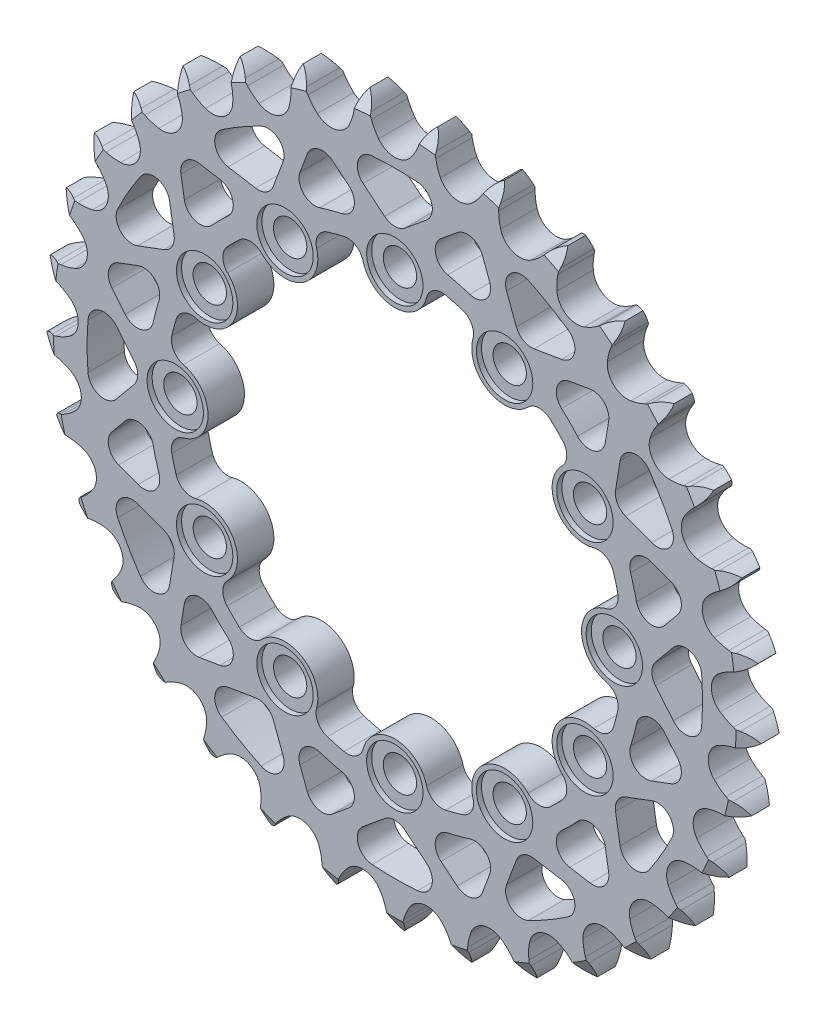
from build123d import *

# Parameters (mm, degrees)
EXTRUSION_DEPTH          = 7.2136
CIRPATTERN1_COUNT        = 12
CUT_EXTRUDE1_DEPTH       = 101.397293257
CUT_EXTRUDE1_DEPTH_BACK  = 101.397293257
SKETCH8_R                = 37
CUT_EXTRUDE2_START       = 7.2136
SKETCH10_R               = 5.588
CUT_EXTRUDE2_DEPTH       = 1.016
CIRPATTERN2_COUNT        = 12
CUT_EXTRUDE3_DEPTH       = 101.397293405
FILLET1_R                = 3.175
CUT_EXTRUDE4_DEPTH       = 101.397293405
FILLET3_R                = 3.175
CIRPATTERN4_COUNT        = 12
FILLET1_OF_CIRPATTERN4_R = 3.175
FILLET3_OF_CIRPATTERN4_R = 3.175


with BuildPart() as part:
    # Teeth Sketch → Extrusion (new body)
    with BuildSketch(Plane.XY):
        with BuildLine():
            ThreePointArc((6.734552875, 70.527428506), (5.727412099, 69.369502295), (5.022388138, 68.006393031))
            Line((5.022388138, 68.006393031), (4.635162245, 66.971544668))
            ThreePointArc((4.635162245, 66.971544668), (4.0137299, 65.635158722), (3.209237245, 64.400291471))
            ThreePointArc((3.209237245, 64.400291471), (0, 62.793862006), (-3.209237245, 64.400291471))
            ThreePointArc((-3.209237245, 64.400291471), (-4.0137299, 65.635158722), (-4.635162245, 66.971544668))
            Line((-4.635162245, 66.971544668), (-5.022388138, 68.006393031))
            ThreePointArc((-5.022388138, 68.006393031), (-5.727412099, 69.369502295), (-6.734552875, 70.527428506))
            ThreePointArc((-6.734552875, 70.527428506), (-7.504354329, 69.199824885), (-7.938667464, 67.727922119))
            Line((-7.938667464, 67.727922119), (-8.123049341, 66.638491832))
            ThreePointArc((-8.123049341, 66.638491832), (-8.48033889, 65.208649276), (-9.036593151, 63.84384645))
            ThreePointArc((-9.036593151, 63.84384645), (-11.883816523, 61.659095115), (-15.339077445, 62.629142165))
            ThreePointArc((-15.339077445, 62.629142165), (-16.362732034, 63.68944252), (-17.22584699, 64.884071387))
            Line((-17.22584699, 64.884071387), (-17.801921547, 65.826935709))
            ThreePointArc((-17.801921547, 65.826935709), (-18.752174931, 67.031985151), (-19.960254337, 67.978383482))
            ThreePointArc((-19.960254337, 67.978383482), (-20.464893839, 66.529085505), (-20.61279894, 65.001587639))
            Line((-20.61279894, 65.001587639), (-20.587672758, 63.896950277))
            ThreePointArc((-20.587672758, 63.896950277), (-20.667906137, 62.425329346), (-20.955817525, 60.979918474))
            ThreePointArc((-20.955817525, 60.979918474), (-23.338120953, 58.295807876), (-26.914523421, 58.594412483))
            ThreePointArc((-26.914523421, 58.594412483), (-28.120342399, 59.441823925), (-29.193944743, 60.451518712))
            Line((-29.193944743, 60.451518712), (-29.938047129, 61.268321421))
            ThreePointArc((-29.938047129, 61.268321421), (-31.099185303, 62.271757414), (-32.464540202, 62.972422563))
            ThreePointArc((-32.464540202, 62.972422563), (-32.685778765, 61.453811636), (-32.541930156, 59.925926421))
            Line((-32.541930156, 59.925926421), (-32.308204042, 58.846006456))
            ThreePointArc((-32.308204042, 58.846006456), (-32.108481407, 57.385795366), (-32.117644055, 55.912017363))
            ThreePointArc((-32.117644055, 55.912017363), (-33.948924886, 52.825558252), (-37.517208396, 52.441928068))
            ThreePointArc((-37.517208396, 52.441928068), (-38.861610323, 53.045822938), (-40.106897269, 53.834090646))
            Line((-40.106897269, 53.834090646), (-40.992133685, 54.495310364))
            ThreePointArc((-40.992133685, 54.495310364), (-42.32219009, 55.260866117), (-43.795472998, 55.69047422))
            ThreePointArc((-43.795472998, 55.69047422), (-43.725314484, 54.157436897), (-43.294911229, 52.684386087))
            Line((-43.294911229, 52.684386087), (-42.861032653, 51.668214641))
            ThreePointArc((-42.861032653, 51.668214641), (-42.388572501, 50.272189225), (-42.118655247, 48.823310267))
            ThreePointArc((-42.118655247, 48.823310267), (-43.33272622, 45.446055318), (-46.763923708, 44.394055736))
            ThreePointArc((-46.763923708, 44.394055736), (-48.198318397, 44.732607702), (-49.570282031, 45.270958281))
            Line((-49.570282031, 45.270958281), (-50.564657725, 45.752696804))
            ThreePointArc((-50.564657725, 45.752696804), (-52.015560657, 46.252703137), (-53.543523293, 46.395727039))
            ThreePointArc((-53.543523293, 46.395727039), (-53.184503413, 44.903671283), (-52.483101407, 43.538694772))
            Line((-52.483101407, 43.538694772), (-51.864751871, 42.622998928))
            ThreePointArc((-51.864751871, 42.622998928), (-51.136630142, 41.341615182), (-50.597388499, 39.970001531))
            ThreePointArc((-50.597388499, 39.970001531), (-51.150369926, 36.424013535), (-54.320468976, 34.741666562))
            ThreePointArc((-54.320468976, 34.741666562), (-55.793013665, 34.802639473), (-57.242067645, 35.071615531))
            Line((-57.242067645, 35.071615531), (-58.309643291, 35.356461573))
            ThreePointArc((-58.309643291, 35.356461573), (-59.828953337, 35.572846956), (-61.356371149, 35.424117399))
            ThreePointArc((-61.356371149, 35.424117399), (-60.721465817, 34.026969994), (-59.774415556, 32.819401589))
            Line((-59.774415556, 32.819401589), (-58.993943824, 32.037276981))
            ThreePointArc((-58.993943824, 32.037276981), (-58.036476735, 30.916847451), (-57.2474003, 29.672072798))
            ThreePointArc((-57.2474003, 29.672072798), (-57.119305992, 26.085513002), (-59.913730964, 23.83362304))
            ThreePointArc((-59.913730964, 23.83362304), (-61.371204052, 23.614813176), (-62.844975793, 23.604693218))
            Line((-62.844975793, 23.604693218), (-63.947166423, 23.682351702))
            ThreePointArc((-63.947166423, 23.682351702), (-65.479971761, 23.607295402), (-66.951639889, 23.17218786))
            ThreePointArc((-66.951639889, 23.17218786), (-66.063796239, 21.920445353), (-64.905326586, 20.913929722))
            Line((-64.905326586, 20.913929722), (-63.99094094, 20.293644371))
            ThreePointArc((-63.99094094, 20.293644371), (-62.838733846, 19.374664301), (-61.828341898, 18.301718044))
            ThreePointArc((-61.828341898, 18.301718044), (-61.023801517, 14.804214063), (-63.341554612, 12.064170283))
            ThreePointArc((-63.341554612, 12.064170283), (-64.731279223, 11.573486003), (-66.176502774, 11.28463579))
            Line((-66.176502774, 11.28463579), (-67.273472348, 11.152299936))
            ThreePointArc((-67.273472348, 11.152299936), (-68.764373399, 10.788514683), (-70.127101923, 10.082755077))
            ThreePointArc((-70.127101923, 10.082755077), (-69.018408937, 9.021658703), (-67.690390004, 8.252573944))
            Line((-67.690390004, 8.252573944), (-66.675138724, 7.816546579))
            ThreePointArc((-66.675138724, 7.816546579), (-65.369835391, 7.132230303), (-64.174646128, 6.269891516))
            ThreePointArc((-64.174646128, 6.269891516), (-62.722737859, 2.987852256), (-64.480049441, -0.14131302))
            ThreePointArc((-64.480049441, -0.14131302), (-65.751797307, -0.886137108), (-67.116238523, -1.443277777))
            Line((-67.116238523, -1.443277777), (-68.168339704, -1.780825007))
            ThreePointArc((-68.168339704, -1.780825007), (-69.563451418, -2.420191065), (-70.767987779, -3.371094744))
            ThreePointArc((-70.767987779, -3.371094744), (-69.478516511, -4.203194198), (-68.028946362, -4.707051357))
            Line((-68.028946362, -4.707051357), (-66.949523274, -4.943061572))
            ThreePointArc((-66.949523274, -4.943061572), (-65.538300765, -5.367981082), (-64.201511441, -5.988545228))
            ThreePointArc((-64.201511441, -5.988545228), (-62.154711032, -8.936498316), (-63.288067282, -12.341688903))
            ThreePointArc((-63.288067282, -12.341688903), (-64.395874122, -13.313732915), (-65.630218543, -14.119027525))
            Line((-65.630218543, -14.119027525), (-66.599425651, -14.649586294))
            ThreePointArc((-66.599425651, -14.649586294), (-67.848325057, -15.541424803), (-68.851134172, -16.703104419))
            ThreePointArc((-68.851134172, -16.703104419), (-67.427489473, -17.276132709), (-65.908759351, -17.496551559))
            Line((-65.908759351, -17.496551559), (-64.804177617, -17.524014599))
            ThreePointArc((-64.804177617, -17.524014599), (-63.338041192, -17.674179644), (-61.907966855, -18.030540344))
            ThreePointArc((-61.907966855, -18.030540344), (-59.340251006, -20.537860555), (-59.808689476, -24.096003993))
            ThreePointArc((-59.808689476, -24.096003993), (-60.712516265, -25.260135726), (-61.772151467, -26.284478831))
            Line((-61.772151467, -26.284478831), (-62.623434833, -26.988873364))
            ThreePointArc((-62.623434833, -26.988873364), (-63.680983452, -28.100950955), (-64.445821187, -29.43142038))
            ThreePointArc((-64.445821187, -29.43142038), (-62.939457285, -29.724666771), (-61.406458053, -29.6536808))
            Line((-61.406458053, -29.6536808), (-60.316640136, -29.471604079))
            ThreePointArc((-60.316640136, -29.471604079), (-58.848579784, -29.341587304), (-57.376907048, -29.420864754))
            ThreePointArc((-57.376907048, -29.420864754), (-54.381079699, -31.396931003), (-54.167669802, -34.979426717))
            ThreePointArc((-54.167669802, -34.979426717), (-54.834849884, -36.293571418), (-55.681477891, -37.499940589))
            Line((-55.681477891, -37.499940589), (-56.384069915, -38.352712231))
            ThreePointArc((-56.384069915, -38.352712231), (-57.212045185, -39.644835523), (-57.711268312, -41.096008126))
            ThreePointArc((-57.711268312, -41.096008126), (-56.176629123, -41.09887393), (-54.684767369, -40.739048756))
            Line((-54.684767369, -40.739048756), (-53.649102126, -40.354013001))
            ThreePointArc((-53.649102126, -40.354013001), (-52.232177374, -39.94851355), (-50.772096325, -39.747842457))
            ThreePointArc((-50.772096325, -39.747842457), (-47.456434483, -41.12123456), (-46.56888941, -44.598601821))
            ThreePointArc((-46.56888941, -44.598601821), (-46.975309158, -46.015262876), (-47.578330627, -47.360056788))
            Line((-47.578330627, -47.360056788), (-48.106837804, -48.330384151))
            ThreePointArc((-48.106837804, -48.330384151), (-48.675314541, -49.755852442), (-48.890879835, -51.275279063))
            ThreePointArc((-48.890879835, -51.275279063), (-47.383431219, -50.987660703), (-45.986626711, -50.352001344))
            Line((-45.986626711, -50.352001344), (-45.042545785, -49.777922752))
            ThreePointArc((-45.042545785, -49.777922752), (-43.727967985, -49.111596431), (-42.332249756, -48.638229571))
            ThreePointArc((-42.332249756, -48.638229571), (-38.816590078, -49.35930956), (-37.28698802, -52.605867255))
            ThreePointArc((-37.28698802, -52.605867255), (-37.417958367, -54.073842843), (-37.75557853, -55.50845714))
            Line((-37.75557853, -55.50845714), (-38.090899233, -56.561270064))
            ThreePointArc((-38.090899233, -56.561270064), (-38.379331208, -58.068563217), (-38.303447577, -59.601327819))
            ThreePointArc((-38.303447577, -59.601327819), (-36.877672653, -59.03362057), (-35.626409548, -58.145101414))
            Line((-35.626409548, -58.145101414), (-34.808034481, -57.402728679))
            ThreePointArc((-34.808034481, -57.402728679), (-33.6433159, -56.499658259), (-32.362405386, -55.770704343))
            ThreePointArc((-32.362405386, -55.770704343), (-28.773812973, -55.813410509), (-26.657437732, -58.711819583))
            ThreePointArc((-26.657437732, -58.711819583), (-26.508225068, -60.178053241), (-26.568241455, -61.650637225))
            Line((-26.568241455, -61.650637225), (-26.69825632, -62.747884308))
            ThreePointArc((-26.69825632, -62.747884308), (-26.696218847, -64.28252482), (-26.331628924, -65.773229298))
            ThreePointArc((-26.331628924, -65.773229298), (-25.039058915, -64.94595158), (-23.978561119, -63.836686022))
            Line((-23.978561119, -63.836686022), (-23.31547012, -62.952850431))
            ThreePointArc((-23.31547012, -62.952850431), (-22.342706722, -61.845675228), (-21.222899365, -60.887480551))
            ThreePointArc((-21.222899365, -60.887480551), (-17.691075297, -60.250269381), (-15.06441819, -62.69577378))
            ThreePointArc((-15.06441819, -62.69577378), (-14.640415448, -64.107272002), (-14.42065891, -65.564602652))
            Line((-14.42065891, -65.564602652), (-14.340668861, -66.666626525))
            ThreePointArc((-14.340668861, -66.666626525), (-14.048235582, -68.17314849), (-13.408116596, -69.567914899))
            ThreePointArc((-13.408116596, -69.567914899), (-12.295468348, -68.510966685), (-11.464065017, -67.221046473))
            Line((-11.464065017, -67.221046473), (-10.980223921, -66.227692145))
            ThreePointArc((-10.980223921, -66.227692145), (-10.23457391, -64.956428358), (-9.316342465, -63.80362457))
            ThreePointArc((-9.316342465, -63.80362457), (-5.968936066, -62.509526537), (-2.926931324, -64.413739359))
            ThreePointArc((-2.926931324, -64.413739359), (-2.24346307, -65.719486924), (-1.751876179, -67.108892511))
            Line((-1.751876179, -67.108892511), (-1.464772265, -68.175863162))
            ThreePointArc((-1.464772265, -68.175863162), (-0.89251248, -69.59981695), (0, -70.848234798))
            ThreePointArc((0, -70.848234798), (0.89251248, -69.59981695), (1.464772265, -68.175863162))
            Line((1.464772265, -68.175863162), (1.751876179, -67.108892511))
            ThreePointArc((1.751876179, -67.108892511), (2.24346307, -65.719486924), (2.926931324, -64.413739359))
            ThreePointArc((2.926931324, -64.413739359), (5.968936066, -62.509526537), (9.316342465, -63.80362457))
            ThreePointArc((9.316342465, -63.80362457), (10.23457391, -64.956428358), (10.980223921, -66.227692145))
            Line((10.980223921, -66.227692145), (11.464065017, -67.221046473))
            ThreePointArc((11.464065017, -67.221046473), (12.295468348, -68.510966685), (13.408116596, -69.567914899))
            ThreePointArc((13.408116596, -69.567914899), (14.048235582, -68.17314849), (14.340668861, -66.666626525))
            Line((14.340668861, -66.666626525), (14.42065891, -65.564602652))
            ThreePointArc((14.42065891, -65.564602652), (14.640415448, -64.107272002), (15.06441819, -62.69577378))
            ThreePointArc((15.06441819, -62.69577378), (17.691075297, -60.250269381), (21.222899365, -60.887480551))
            ThreePointArc((21.222899365, -60.887480551), (22.342706722, -61.845675228), (23.31547012, -62.952850431))
            Line((23.31547012, -62.952850431), (23.978561119, -63.836686022))
            ThreePointArc((23.978561119, -63.836686022), (25.039058915, -64.94595158), (26.331628924, -65.773229298))
            ThreePointArc((26.331628924, -65.773229298), (26.696218847, -64.28252482), (26.69825632, -62.747884308))
            Line((26.69825632, -62.747884308), (26.568241455, -61.650637225))
            ThreePointArc((26.568241455, -61.650637225), (26.508225068, -60.178053241), (26.657437732, -58.711819583))
            ThreePointArc((26.657437732, -58.711819583), (28.773812973, -55.813410509), (32.362405386, -55.770704343))
            ThreePointArc((32.362405386, -55.770704343), (33.6433159, -56.499658259), (34.808034481, -57.402728679))
            Line((34.808034481, -57.402728679), (35.626409548, -58.145101414))
            ThreePointArc((35.626409548, -58.145101414), (36.877672653, -59.03362057), (38.303447577, -59.601327819))
            ThreePointArc((38.303447577, -59.601327819), (38.379331208, -58.068563217), (38.090899233, -56.561270064))
            Line((38.090899233, -56.561270064), (37.75557853, -55.50845714))
            ThreePointArc((37.75557853, -55.50845714), (37.417958367, -54.073842843), (37.28698802, -52.605867255))
            ThreePointArc((37.28698802, -52.605867255), (38.816590078, -49.35930956), (42.332249756, -48.638229571))
            ThreePointArc((42.332249756, -48.638229571), (43.727967985, -49.111596431), (45.042545785, -49.777922752))
            Line((45.042545785, -49.777922752), (45.986626711, -50.352001344))
            ThreePointArc((45.986626711, -50.352001344), (47.383431219, -50.987660703), (48.890879835, -51.275279063))
            ThreePointArc((48.890879835, -51.275279063), (48.675314541, -49.755852442), (48.106837804, -48.330384151))
            Line((48.106837804, -48.330384151), (47.578330627, -47.360056788))
            ThreePointArc((47.578330627, -47.360056788), (46.975309158, -46.015262876), (46.56888941, -44.598601821))
            ThreePointArc((46.56888941, -44.598601821), (47.456434483, -41.12123456), (50.772096325, -39.747842457))
            ThreePointArc((50.772096325, -39.747842457), (52.232177374, -39.94851355), (53.649102126, -40.354013001))
            Line((53.649102126, -40.354013001), (54.684767369, -40.739048756))
            ThreePointArc((54.684767369, -40.739048756), (56.176629123, -41.09887393), (57.711268312, -41.096008126))
            ThreePointArc((57.711268312, -41.096008126), (57.212045185, -39.644835523), (56.384069915, -38.352712231))
            Line((56.384069915, -38.352712231), (55.681477891, -37.499940589))
            ThreePointArc((55.681477891, -37.499940589), (54.834849884, -36.293571418), (54.167669802, -34.979426717))
            ThreePointArc((54.167669802, -34.979426717), (54.381079699, -31.396931003), (57.376907048, -29.420864754))
            ThreePointArc((57.376907048, -29.420864754), (58.848579784, -29.341587304), (60.316640136, -29.471604079))
            Line((60.316640136, -29.471604079), (61.406458053, -29.6536808))
            ThreePointArc((61.406458053, -29.6536808), (62.939457285, -29.724666771), (64.445821187, -29.43142038))
            ThreePointArc((64.445821187, -29.43142038), (63.680983452, -28.100950955), (62.623434833, -26.988873364))
            Line((62.623434833, -26.988873364), (61.772151467, -26.284478831))
            ThreePointArc((61.772151467, -26.284478831), (60.712516265, -25.260135726), (59.808689476, -24.096003993))
            ThreePointArc((59.808689476, -24.096003993), (59.340251006, -20.537860555), (61.907966855, -18.030540344))
            ThreePointArc((61.907966855, -18.030540344), (63.338041192, -17.674179644), (64.804177617, -17.524014599))
            Line((64.804177617, -17.524014599), (65.908759351, -17.496551559))
            ThreePointArc((65.908759351, -17.496551559), (67.427489473, -17.276132709), (68.851134172, -16.703104419))
            ThreePointArc((68.851134172, -16.703104419), (67.848325057, -15.541424803), (66.599425651, -14.649586294))
            Line((66.599425651, -14.649586294), (65.630218543, -14.119027525))
            ThreePointArc((65.630218543, -14.119027525), (64.395874122, -13.313732915), (63.288067282, -12.341688903))
            ThreePointArc((63.288067282, -12.341688903), (62.154711032, -8.936498316), (64.201511441, -5.988545228))
            ThreePointArc((64.201511441, -5.988545228), (65.538300765, -5.367981082), (66.949523274, -4.943061572))
            Line((66.949523274, -4.943061572), (68.028946362, -4.707051357))
            ThreePointArc((68.028946362, -4.707051357), (69.478516511, -4.203194198), (70.767987779, -3.371094744))
            ThreePointArc((70.767987779, -3.371094744), (69.563451418, -2.420191065), (68.168339704, -1.780825007))
            Line((68.168339704, -1.780825007), (67.116238523, -1.443277777))
            ThreePointArc((67.116238523, -1.443277777), (65.751797307, -0.886137108), (64.480049441, -0.14131302))
            ThreePointArc((64.480049441, -0.14131302), (62.722737859, 2.987852256), (64.174646128, 6.269891516))
            ThreePointArc((64.174646128, 6.269891516), (65.369835391, 7.132230303), (66.675138724, 7.816546579))
            Line((66.675138724, 7.816546579), (67.690390004, 8.252573944))
            ThreePointArc((67.690390004, 8.252573944), (69.018408937, 9.021658703), (70.127101923, 10.082755077))
            ThreePointArc((70.127101923, 10.082755077), (68.764373399, 10.788514683), (67.273472348, 11.152299936))
            Line((67.273472348, 11.152299936), (66.176502774, 11.28463579))
            ThreePointArc((66.176502774, 11.28463579), (64.731279223, 11.573486003), (63.341554612, 12.064170283))
            ThreePointArc((63.341554612, 12.064170283), (61.023801517, 14.804214063), (61.828341898, 18.301718044))
            ThreePointArc((61.828341898, 18.301718044), (62.838733846, 19.374664301), (63.99094094, 20.293644371))
            Line((63.99094094, 20.293644371), (64.905326586, 20.913929722))
            ThreePointArc((64.905326586, 20.913929722), (66.063796239, 21.920445353), (66.951639889, 23.17218786))
            ThreePointArc((66.951639889, 23.17218786), (65.479971761, 23.607295402), (63.947166423, 23.682351702))
            Line((63.947166423, 23.682351702), (62.844975793, 23.604693218))
            ThreePointArc((62.844975793, 23.604693218), (61.371204052, 23.614813176), (59.913730964, 23.83362304))
            ThreePointArc((59.913730964, 23.83362304), (57.119305992, 26.085513002), (57.2474003, 29.672072798))
            ThreePointArc((57.2474003, 29.672072798), (58.036476735, 30.916847451), (58.993943824, 32.037276981))
            Line((58.993943824, 32.037276981), (59.774415556, 32.819401589))
            ThreePointArc((59.774415556, 32.819401589), (60.721465817, 34.026969994), (61.356371149, 35.424117399))
            ThreePointArc((61.356371149, 35.424117399), (59.828953337, 35.572846956), (58.309643291, 35.356461573))
            Line((58.309643291, 35.356461573), (57.242067645, 35.071615531))
            ThreePointArc((57.242067645, 35.071615531), (55.793013665, 34.802639473), (54.320468976, 34.741666562))
            ThreePointArc((54.320468976, 34.741666562), (51.150369926, 36.424013535), (50.597388499, 39.970001531))
            ThreePointArc((50.597388499, 39.970001531), (51.136630142, 41.341615182), (51.864751871, 42.622998928))
            Line((51.864751871, 42.622998928), (52.483101407, 43.538694772))
            ThreePointArc((52.483101407, 43.538694772), (53.184503413, 44.903671283), (53.543523293, 46.395727039))
            ThreePointArc((53.543523293, 46.395727039), (52.015560657, 46.252703137), (50.564657725, 45.752696804))
            Line((50.564657725, 45.752696804), (49.570282031, 45.270958281))
            ThreePointArc((49.570282031, 45.270958281), (48.198318397, 44.732607702), (46.763923708, 44.394055736))
            ThreePointArc((46.763923708, 44.394055736), (43.33272622, 45.446055318), (42.118655247, 48.823310267))
            ThreePointArc((42.118655247, 48.823310267), (42.388572501, 50.272189225), (42.861032653, 51.668214641))
            Line((42.861032653, 51.668214641), (43.294911229, 52.684386087))
            ThreePointArc((43.294911229, 52.684386087), (43.725314484, 54.157436897), (43.795472998, 55.69047422))
            ThreePointArc((43.795472998, 55.69047422), (42.32219009, 55.260866117), (40.992133685, 54.495310364))
            Line((40.992133685, 54.495310364), (40.106897269, 53.834090646))
            ThreePointArc((40.106897269, 53.834090646), (38.861610323, 53.045822938), (37.517208396, 52.441928068))
            ThreePointArc((37.517208396, 52.441928068), (33.948924886, 52.825558252), (32.117644055, 55.912017363))
            ThreePointArc((32.117644055, 55.912017363), (32.108481407, 57.385795366), (32.308204042, 58.846006456))
            Line((32.308204042, 58.846006456), (32.541930156, 59.925926421))
            ThreePointArc((32.541930156, 59.925926421), (32.685778765, 61.453811636), (32.464540202, 62.972422563))
            ThreePointArc((32.464540202, 62.972422563), (31.099185303, 62.271757414), (29.938047129, 61.268321421))
            Line((29.938047129, 61.268321421), (29.193944743, 60.451518712))
            ThreePointArc((29.193944743, 60.451518712), (28.120342399, 59.441823925), (26.914523421, 58.594412483))
            ThreePointArc((26.914523421, 58.594412483), (23.338120953, 58.295807876), (20.955817525, 60.979918474))
            ThreePointArc((20.955817525, 60.979918474), (20.667906137, 62.425329346), (20.587672758, 63.896950277))
            Line((20.587672758, 63.896950277), (20.61279894, 65.001587639))
            ThreePointArc((20.61279894, 65.001587639), (20.464893839, 66.529085505), (19.960254337, 67.978383482))
            ThreePointArc((19.960254337, 67.978383482), (18.752174931, 67.031985151), (17.801921547, 65.826935709))
            Line((17.801921547, 65.826935709), (17.22584699, 64.884071387))
            ThreePointArc((17.22584699, 64.884071387), (16.362732034, 63.68944252), (15.339077445, 62.629142165))
            ThreePointArc((15.339077445, 62.629142165), (11.883816523, 61.659095115), (9.036593151, 63.84384645))
            ThreePointArc((9.036593151, 63.84384645), (8.48033889, 65.208649276), (8.123049341, 66.638491832))
            Line((8.123049341, 66.638491832), (7.938667464, 67.727922119))
            ThreePointArc((7.938667464, 67.727922119), (7.504354329, 69.199824885), (6.734552875, 70.527428506))
        make_face()
    extrude(amount=EXTRUSION_DEPTH)

    # Sketch7 → M6 Clearance Hole1 (revolve, cut)
    with BuildSketch(Plane(origin=(0, 43.500000122, 0), x_dir=(0, 1, 0), z_dir=(1, 0, 0))):
        Polygon((0, 0), (0, 19.254840043), (3.3, 17.272), (3.3, 0), align=None)
    m6_clearance_hole1 = revolve(axis=Axis((0, 43.500000122, -6.35), (0, 0, 1)), mode=Mode.SUBTRACT)

    # CirPattern1: M6 Clearance Hole1 ×12 about axis
    cirpattern1_axis = Axis((0, 0, 0), (0, 0, 1))
    for i in range(1, CIRPATTERN1_COUNT):
        add(m6_clearance_hole1.rotate(cirpattern1_axis, i * 360 / CIRPATTERN1_COUNT), mode=Mode.SUBTRACT)

    # Sketch8 → Cut-Extrude1 (cut, two sides: drawn at the far end of the back side and taken through both)
    with BuildSketch(Plane(origin=(0, 0, 0), x_dir=(-1, 0, 0), z_dir=(0, 0, -1)).offset(-CUT_EXTRUDE1_DEPTH_BACK)):
        Circle(SKETCH8_R)
    extrude(amount=CUT_EXTRUDE1_DEPTH + CUT_EXTRUDE1_DEPTH_BACK, mode=Mode.SUBTRACT)

    # Sketch5 → Cut-Revolve1 (revolve, cut)
    with BuildSketch(Plane(origin=(0, 0, 0), x_dir=(0, 0, -1), z_dir=(1, 0, 0))):
        Polygon((-7.2136, -67.654652666), (-7.2136, -70.848234798), (-5.3848, -70.848234798), align=None)
    cut_revolve1 = revolve(axis=Axis((0, 0, 7.2136), (0, 0, -1)), mode=Mode.SUBTRACT)

    # Mirror1: Cut-Revolve1 across plane
    add(cut_revolve1.mirror(Plane.XY.offset(3.6068)), mode=Mode.SUBTRACT)

    # Sketch10 → Cut-Extrude2 (cut)
    with BuildSketch(Plane.XY.offset(CUT_EXTRUDE2_START)):
        with Locations((-43.500000122, 0)):
            Circle(SKETCH10_R)
    cut_extrude2 = extrude(amount=-CUT_EXTRUDE2_DEPTH, mode=Mode.SUBTRACT)

    # CirPattern2: Cut-Extrude2 ×12 about axis
    cirpattern2_axis = Axis((0, 0, 0), (0, 0, 1))
    for i in range(1, CIRPATTERN2_COUNT):
        add(cut_extrude2.rotate(cirpattern2_axis, i * 360 / CIRPATTERN2_COUNT), mode=Mode.SUBTRACT)

    # Sketch12 → Cut-Extrude3 (cut, through all)
    with BuildSketch(Plane.XY):
        with BuildLine():
            Line((-44.155808939, 21.290014165), (-58.882838371, 15.777608989))
            Line((-58.882838371, 15.777608989), (-48.885059348, 3.640211356))
            ThreePointArc((-48.885059348, 3.640211356), (-47.350075794, 12.687414571), (-44.155808939, 21.290014165))
        make_face()
        with BuildLine():
            ThreePointArc((-42.036279294, 16.932948494), (-43.774385004, 11.729311111), (-44.870959996, 6.353776091))
            ThreePointArc((-44.870959996, 6.353776091), (-39.41718478, 5.057728786), (-37, 0))
            ThreePointArc((-37, 0), (-35.739255573, 9.576304669), (-32.04293994, 18.5))
            ThreePointArc((-32.04293994, 18.5), (-36.665147758, 15.328470776), (-42.036279294, 16.932948494))
        make_face()
    cut_extrude3 = extrude(amount=CUT_EXTRUDE3_DEPTH, mode=Mode.SUBTRACT)

    # Fillet1
    fillet1_edges = [part.edges().sort_by_distance(p)[0] for p in [
        (-58.882838371, 15.777608989, 3.6068),
        (-48.885059348, 3.640211356, 3.6068),
        (-44.155808939, 21.290014165, 3.6068),
        (-42.036279294, 16.932948494, 3.6068),
        (-44.870959996, 6.353776091, 3.6068),
    ]]
    fillet(fillet1_edges, radius=FILLET1_R)

    # Sketch12<3> → Cut-Extrude4 (cut, through all)
    with BuildSketch(Plane.XY):
        with BuildLine():
            ThreePointArc((-59.790139252, -11.885320706), (-60.96, 0), (-59.790139252, 11.885320706))
            Line((-59.790139252, 11.885320706), (-50.000000244, 0))
            Line((-50.000000244, 0), (-59.790139252, -11.885320706))
        make_face()
    cut_extrude4 = extrude(amount=CUT_EXTRUDE4_DEPTH, mode=Mode.SUBTRACT)

    # Fillet3
    fillet3_edges = [part.edges().sort_by_distance(p)[0] for p in [
        (-59.790139252, 11.885320706, 3.6068),
        (-59.790139252, -11.885320706, 3.6068),
        (-50.000000244, 0, 3.6068),
    ]]
    fillet(fillet3_edges, radius=FILLET3_R)

    # CirPattern4: Cut-Extrude3, Cut-Extrude4 ×12 about axis
    cirpattern4_axis = Axis((0, 0, 0), (0, 0, 1))
    add([cut_extrude3.rotate(cirpattern4_axis, i * 360 / CIRPATTERN4_COUNT) for i in range(1, CIRPATTERN4_COUNT)], mode=Mode.SUBTRACT)
    add([cut_extrude4.rotate(cirpattern4_axis, i * 360 / CIRPATTERN4_COUNT) for i in range(1, CIRPATTERN4_COUNT)], mode=Mode.SUBTRACT)

    # Fillet1 of CirPattern4
    fillet1_of_cirpattern4_edges = [part.edges().sort_by_distance(p)[0] for p in [
        (-58.882838371, -15.777608989, 3.6068),
        (-44.155808939, -21.290014165, 3.6068),
        (-48.885059348, -3.640211356, 3.6068),
        (-44.870959996, -6.353776091, 3.6068),
        (-42.036279294, -16.932948494, 3.6068),
        (-43.105229381, -43.105229381, 3.6068),
        (-27.595045183, -40.515597583, 3.6068),
        (-40.515597583, -27.595045183, 3.6068),
        (-35.682503204, -27.938011503, 3.6068),
        (-27.938011503, -35.682503204, 3.6068),
        (-15.777608989, -58.882838371, 3.6068),
        (-3.640211356, -48.885059348, 3.6068),
        (-21.290014165, -44.155808939, 3.6068),
        (-16.932948494, -42.036279294, 3.6068),
        (-6.353776091, -44.870959996, 3.6068),
        (15.777608989, -58.882838371, 3.6068),
        (21.290014165, -44.155808939, 3.6068),
        (3.640211356, -48.885059348, 3.6068),
        (6.353776091, -44.870959996, 3.6068),
        (16.932948494, -42.036279294, 3.6068),
        (43.105229381, -43.105229381, 3.6068),
        (40.515597583, -27.595045183, 3.6068),
        (27.595045183, -40.515597583, 3.6068),
        (27.938011503, -35.682503204, 3.6068),
        (35.682503204, -27.938011503, 3.6068),
        (58.882838371, -15.777608989, 3.6068),
        (48.885059348, -3.640211356, 3.6068),
        (44.155808939, -21.290014165, 3.6068),
        (42.036279294, -16.932948494, 3.6068),
        (44.870959996, -6.353776091, 3.6068),
        (58.882838371, 15.777608989, 3.6068),
        (44.155808939, 21.290014165, 3.6068),
        (48.885059348, 3.640211356, 3.6068),
        (44.870959996, 6.353776091, 3.6068),
        (42.036279294, 16.932948494, 3.6068),
        (43.105229381, 43.105229381, 3.6068),
        (27.595045183, 40.515597583, 3.6068),
        (40.515597583, 27.595045183, 3.6068),
        (35.682503204, 27.938011503, 3.6068),
        (27.938011503, 35.682503204, 3.6068),
        (15.777608989, 58.882838371, 3.6068),
        (3.640211356, 48.885059348, 3.6068),
        (21.290014165, 44.155808939, 3.6068),
        (16.932948494, 42.036279294, 3.6068),
        (6.353776091, 44.870959996, 3.6068),
        (-15.777608989, 58.882838371, 3.6068),
        (-21.290014165, 44.155808939, 3.6068),
        (-3.640211356, 48.885059348, 3.6068),
        (-6.353776091, 44.870959996, 3.6068),
        (-16.932948494, 42.036279294, 3.6068),
        (-43.105229381, 43.105229381, 3.6068),
        (-40.515597583, 27.595045183, 3.6068),
        (-27.595045183, 40.515597583, 3.6068),
        (-27.938011503, 35.682503204, 3.6068),
        (-35.682503204, 27.938011503, 3.6068),
    ]]
    fillet(fillet1_of_cirpattern4_edges, radius=FILLET1_OF_CIRPATTERN4_R)

    # Fillet3 of CirPattern4
    fillet3_of_cirpattern4_edges = [part.edges().sort_by_distance(p)[0] for p in [
        (-57.722439841, -19.602079962, 3.6068),
        (-45.837119135, -40.188059289, 3.6068),
        (-43.301270401, -25.000000122, 3.6068),
        (-40.188059289, -45.837119135, 3.6068),
        (-19.602079962, -57.722439841, 3.6068),
        (-25.000000122, -43.301270401, 3.6068),
        (-11.885320706, -59.790139252, 3.6068),
        (11.885320706, -59.790139252, 3.6068),
        (0, -50.000000244, 3.6068),
        (19.602079962, -57.722439841, 3.6068),
        (40.188059289, -45.837119135, 3.6068),
        (25.000000122, -43.301270401, 3.6068),
        (45.837119135, -40.188059289, 3.6068),
        (57.722439841, -19.602079962, 3.6068),
        (43.301270401, -25.000000122, 3.6068),
        (59.790139252, -11.885320706, 3.6068),
        (59.790139252, 11.885320706, 3.6068),
        (50.000000244, 0, 3.6068),
        (57.722439841, 19.602079962, 3.6068),
        (45.837119135, 40.188059289, 3.6068),
        (43.301270401, 25.000000122, 3.6068),
        (40.188059289, 45.837119135, 3.6068),
        (19.602079962, 57.722439841, 3.6068),
        (25.000000122, 43.301270401, 3.6068),
        (11.885320706, 59.790139252, 3.6068),
        (-11.885320706, 59.790139252, 3.6068),
        (0, 50.000000244, 3.6068),
        (-19.602079962, 57.722439841, 3.6068),
        (-40.188059289, 45.837119135, 3.6068),
        (-25.000000122, 43.301270401, 3.6068),
        (-45.837119135, 40.188059289, 3.6068),
        (-57.722439841, 19.602079962, 3.6068),
        (-43.301270401, 25.000000122, 3.6068),
    ]]
    fillet(fillet3_of_cirpattern4_edges, radius=FILLET3_OF_CIRPATTERN4_R)


solid = part.part
